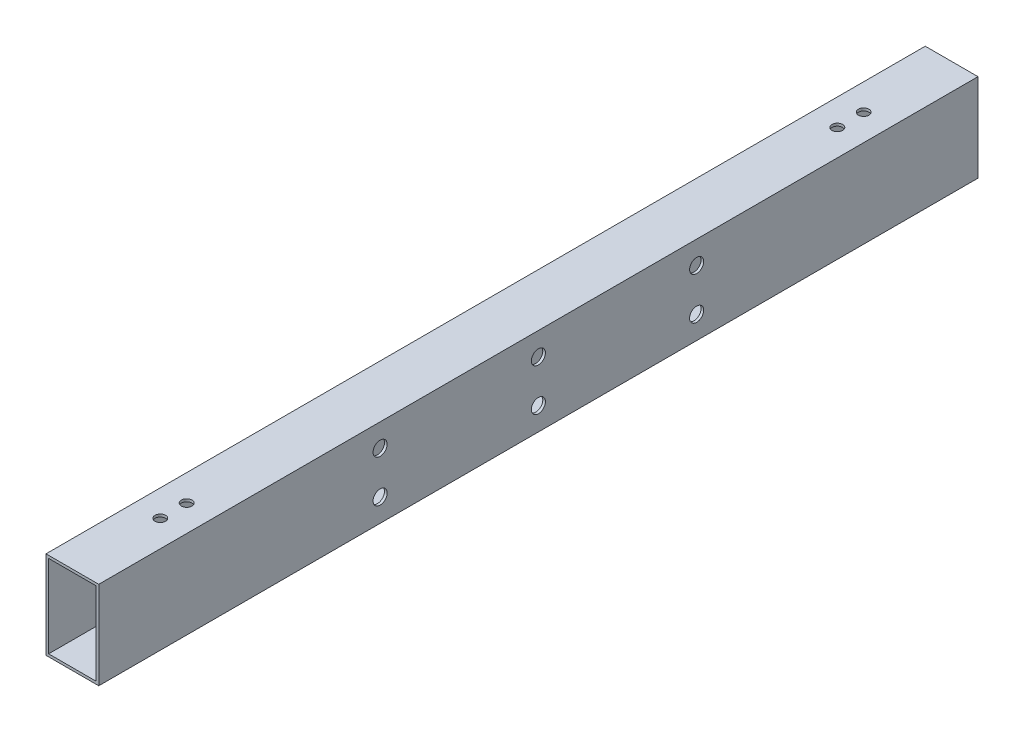
from build123d import *

# Parameters (mm, degrees)
SZKIC1_W                    = 30
SZKIC1_H                    = 50
DODANIE_WYCI_GNI_CIE1_DEPTH = 500
SZKIC2_W                    = 27
SZKIC2_H                    = 47
WYTNIJ_WYCI_GNI_CIE7_DEPTH  = 504.388517946
SZKIC5_R                    = 3
WYTNIJ_WYCI_GNI_CIE13_DEPTH = 504.388517946
SZKIC6_R                    = 4
WYTNIJ_WYCI_GNI_CIE14_DEPTH = 504.388517946


with BuildPart() as part:
    # Szkic1 → Dodanie-wyciągnięcie1 (new body)
    with BuildSketch(Plane.XY):
        with Locations((15, 25)):
            Rectangle(SZKIC1_W, SZKIC1_H)
    extrude(amount=DODANIE_WYCI_GNI_CIE1_DEPTH)

    # Szkic2 → Wytnij-wyciągnięcie7 (cut, through all)
    with BuildSketch(Plane.XY):
        with Locations((15, 25)):
            Rectangle(SZKIC2_W, SZKIC2_H)
    extrude(amount=WYTNIJ_WYCI_GNI_CIE7_DEPTH, mode=Mode.SUBTRACT)

    # Szkic5 → Wytnij-wyciągnięcie13 (cut, through all)
    with BuildSketch(Plane(origin=(0, 0, 0), x_dir=(1, 0, 0), z_dir=(0, 1, 0))):
        with Locations((15, -450)):
            Circle(SZKIC5_R)
        with Locations((15, -435)):
            Circle(SZKIC5_R)
        with Locations((15, -50)):
            Circle(SZKIC5_R)
        with Locations((15, -65)):
            Circle(SZKIC5_R)
    extrude(amount=WYTNIJ_WYCI_GNI_CIE13_DEPTH, mode=Mode.SUBTRACT)

    # Szkic6 → Wytnij-wyciągnięcie14 (cut, through all)
    with BuildSketch(Plane(origin=(30, 0, 0), x_dir=(0, 0, -1), z_dir=(1, 0, 0))):
        with Locations((-250, 37)):
            Circle(SZKIC6_R)
        with Locations((-250, 13)):
            Circle(SZKIC6_R)
        with Locations((-340, 13)):
            Circle(SZKIC6_R)
        with Locations((-340, 37)):
            Circle(SZKIC6_R)
        with Locations((-160, 13)):
            Circle(SZKIC6_R)
        with Locations((-160, 37)):
            Circle(SZKIC6_R)
    extrude(amount=-WYTNIJ_WYCI_GNI_CIE14_DEPTH, mode=Mode.SUBTRACT)


solid = part.part
